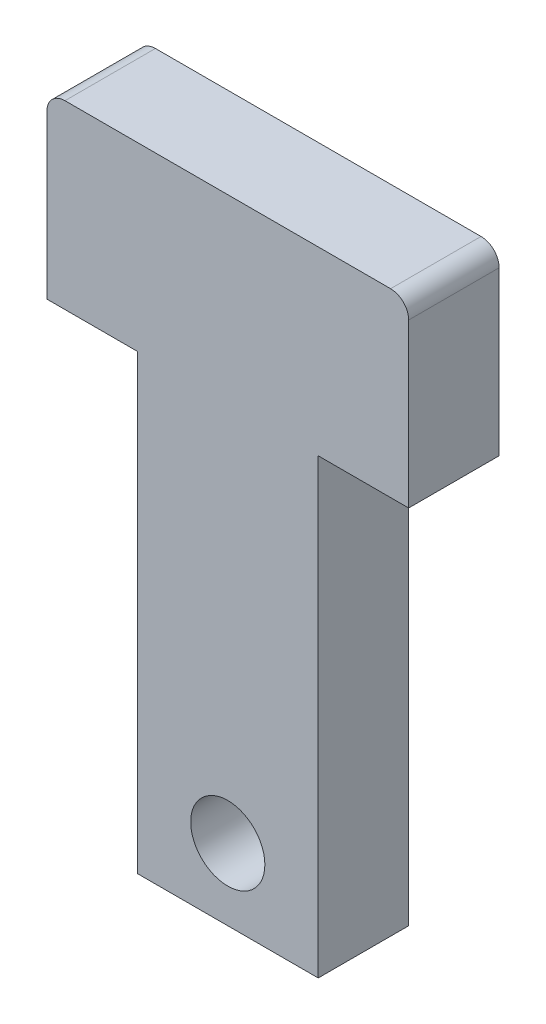
from build123d import *

# Parameters (mm, degrees)
SKETCH_1_R      = 2.05
EXTRUDE_1_DEPTH = 5


with BuildPart() as part:
    # 草圖1 → 填料-伸長1 (new body)
    with BuildSketch(Plane.XY):
        with BuildLine():
            Line((-5, -4.5), (-10, -4.5))
            Line((-10, -4.5), (-10, 4.5))
            ThreePointArc((-10, 4.5), (-9.707106781, 5.207106781), (-9, 5.5))
            Line((-9, 5.5), (9, 5.5))
            ThreePointArc((9, 5.5), (9.707106781, 5.207106781), (10, 4.5))
            Line((10, 4.5), (10, -4.5))
            Line((10, -4.5), (5, -4.5))
            Line((5, -4.5), (5, -29.5))
            Line((5, -29.5), (-5, -29.5))
            Line((-5, -29.5), (-5, -4.5))
        make_face()
        with Locations((0, -25.55)):
            Circle(SKETCH_1_R, mode=Mode.SUBTRACT)
    extrude(amount=EXTRUDE_1_DEPTH)


solid = part.part
